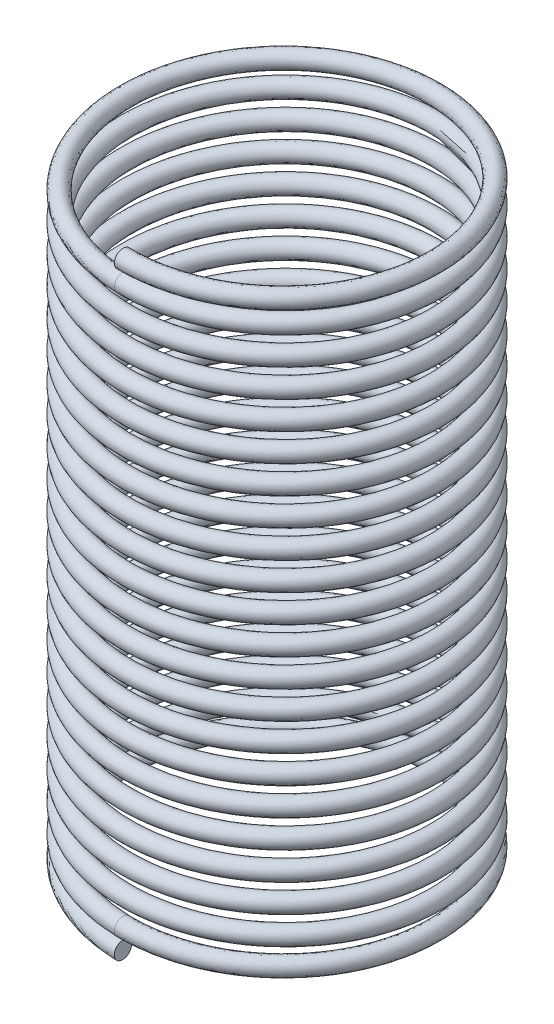
from build123d import *

# Parameters (mm, degrees)
SKETCH9_R = 0.25


with BuildPart() as part:
    # Sweep3: sweep along a curve in space
    with BuildLine() as sweep3_path:
        add(Edge.make_bspline(
            [(0, -0.6, 4.5), (-0.585272672, -0.587580128, 4.5), (-1.768623705, -0.562462812, 4.265693422), (-3.264360697, -0.525009964, 3.2648204), (-4.265816599, -0.48749733, 1.766908068), (-4.617120285, -0.450000715, 0), (-4.265702263, -0.412499808, -1.766908068), (-3.264818043, -0.375000051, -3.2648204), (-1.766908658, -0.337499987, -4.265693422), (0, -0.3, -4.617153289), (1.766908658, -0.262500013, -4.265693422), (3.264818043, -0.224999949, -3.2648204), (4.265702263, -0.187500192, -1.766908068), (4.617120285, -0.149999285, 0), (4.265816599, -0.11250267, 1.766908068), (3.264360697, -0.074990036, 3.2648204), (1.768623705, -0.037537188, 4.265693422), (0.585272672, -0.012419872, 4.5), (0, 0, 4.5)],
            knots=[0, 0, 0, 0, 0.0625, 0.125, 0.1875, 0.25, 0.3125, 0.375, 0.4375, 0.5, 0.5625, 0.625, 0.6875, 0.75, 0.8125, 0.875, 0.9375, 1, 1, 1, 1], degree=3))
        add(Edge.make_bspline(
            [(0, 0, 4.5), (-0.585274074, 0.016766867, 4.5), (-1.768623055, 0.050675185, 4.265693422), (-3.264360871, 0.101236553, 3.2648204), (-4.265816553, 0.151878603, 1.766908068), (-4.617120296, 0.202499035, 0), (-4.265702262, 0.253125259, -1.766908068), (-3.264818032, 0.303749931, -3.2648204), (-1.766908703, 0.354375019, -4.265693422), (1.7e-07, 0.404999995, -4.617153289), (1.766908023, 0.455625001, -4.265693422), (3.264820413, 0.50625, -3.2648204), (4.265693419, 0.556875, -1.766908068), (4.61715329, 0.6075, 0), (4.265693422, 0.658125, 1.766908068), (3.2648204, 0.70875, 3.2648204), (1.766908068, 0.759375, 4.265693422), (0, 0.81, 4.617153289), (-1.766908068, 0.860625, 4.265693422), (-3.2648204, 0.91125, 3.2648204), (-4.265693422, 0.961875, 1.766908068), (-4.617153289, 1.0125, 0), (-4.265693422, 1.063125, -1.766908068), (-3.2648204, 1.11375, -3.2648204), (-1.766908068, 1.164375, -4.265693422), (0, 1.215, -4.617153289), (1.766908068, 1.265625, -4.265693422), (3.2648204, 1.31625, -3.2648204), (4.265693422, 1.366875, -1.766908068), (4.617153289, 1.4175, 0), (4.265693422, 1.468125, 1.766908068), (3.2648204, 1.51875, 3.2648204), (1.766908068, 1.569375, 4.265693422), (0, 1.62, 4.617153289), (-1.766908068, 1.670625, 4.265693422), (-3.2648204, 1.72125, 3.2648204), (-4.265693422, 1.771875, 1.766908068), (-4.617153289, 1.8225, 0), (-4.265693422, 1.873125, -1.766908068), (-3.2648204, 1.92375, -3.2648204), (-1.766908068, 1.974375, -4.265693422), (0, 2.025, -4.617153289), (1.766908068, 2.075625, -4.265693422), (3.2648204, 2.12625, -3.2648204), (4.265693422, 2.176875, -1.766908068), (4.617153289, 2.2275, 0), (4.265693422, 2.278125, 1.766908068), (3.2648204, 2.32875, 3.2648204), (1.766908068, 2.379375, 4.265693422), (0, 2.43, 4.617153289), (-1.766908068, 2.480625, 4.265693422), (-3.2648204, 2.53125, 3.2648204), (-4.265693422, 2.581875, 1.766908068), (-4.617153289, 2.6325, 0), (-4.265693422, 2.683125, -1.766908068), (-3.2648204, 2.73375, -3.2648204), (-1.766908068, 2.784375, -4.265693422), (0, 2.835, -4.617153289), (1.766908068, 2.885625, -4.265693422), (3.2648204, 2.93625, -3.2648204), (4.265693422, 2.986875, -1.766908068), (4.617153289, 3.0375, 0), (4.265693422, 3.088125, 1.766908068), (3.2648204, 3.13875, 3.2648204), (1.766908068, 3.189375, 4.265693422), (0, 3.24, 4.617153289), (-1.766908068, 3.290625, 4.265693422), (-3.2648204, 3.34125, 3.2648204), (-4.265693422, 3.391875, 1.766908068), (-4.617153289, 3.4425, 0), (-4.265693422, 3.493125, -1.766908068), (-3.2648204, 3.54375, -3.2648204), (-1.766908068, 3.594375, -4.265693422), (0, 3.645, -4.617153289), (1.766908068, 3.695625, -4.265693422), (3.2648204, 3.74625, -3.2648204), (4.265693422, 3.796875, -1.766908068), (4.617153289, 3.8475, 0), (4.265693422, 3.898125, 1.766908068), (3.2648204, 3.94875, 3.2648204), (1.766908068, 3.999375, 4.265693422), (0, 4.05, 4.617153289), (-1.766908068, 4.100625, 4.265693422), (-3.2648204, 4.15125, 3.2648204), (-4.265693422, 4.201875, 1.766908068), (-4.617153289, 4.2525, 0), (-4.265693422, 4.303125, -1.766908068), (-3.2648204, 4.35375, -3.2648204), (-1.766908068, 4.404375, -4.265693422), (0, 4.455, -4.617153289), (1.766908068, 4.505625, -4.265693422), (3.2648204, 4.55625, -3.2648204), (4.265693422, 4.606875, -1.766908068), (4.617153289, 4.6575, 0), (4.265693422, 4.708125, 1.766908068), (3.2648204, 4.75875, 3.2648204), (1.766908068, 4.809375, 4.265693422), (0, 4.86, 4.617153289), (-1.766908068, 4.910625, 4.265693422), (-3.2648204, 4.96125, 3.2648204), (-4.265693422, 5.011875, 1.766908068), (-4.617153289, 5.0625, 0), (-4.265693422, 5.113125, -1.766908068), (-3.2648204, 5.16375, -3.2648204), (-1.766908068, 5.214375, -4.265693422), (0, 5.265, -4.617153289), (1.766908068, 5.315625, -4.265693422), (3.2648204, 5.36625, -3.2648204), (4.265693422, 5.416875, -1.766908068), (4.617153289, 5.4675, 0), (4.265693422, 5.518125, 1.766908068), (3.2648204, 5.56875, 3.2648204), (1.766908068, 5.619375, 4.265693422), (0, 5.67, 4.617153289), (-1.766908068, 5.720625, 4.265693422), (-3.2648204, 5.77125, 3.2648204), (-4.265693422, 5.821875, 1.766908068), (-4.617153289, 5.8725, 0), (-4.265693422, 5.923125, -1.766908068), (-3.2648204, 5.97375, -3.2648204), (-1.766908068, 6.024375, -4.265693422), (0, 6.075, -4.617153289), (1.766908068, 6.125625, -4.265693422), (3.2648204, 6.17625, -3.2648204), (4.265693422, 6.226875, -1.766908068), (4.617153289, 6.2775, 0), (4.265693422, 6.328125, 1.766908068), (3.2648204, 6.37875, 3.2648204), (1.766908068, 6.429375, 4.265693422), (0, 6.48, 4.617153289), (-1.766908068, 6.530625, 4.265693422), (-3.2648204, 6.58125, 3.2648204), (-4.265693422, 6.631875, 1.766908068), (-4.617153289, 6.6825, 0), (-4.265693422, 6.733125, -1.766908068), (-3.2648204, 6.78375, -3.2648204), (-1.766908068, 6.834375, -4.265693422), (0, 6.885, -4.617153289), (1.766908068, 6.935625, -4.265693422), (3.2648204, 6.98625, -3.2648204), (4.265693422, 7.036875, -1.766908068), (4.617153289, 7.0875, 0), (4.265693422, 7.138125, 1.766908068), (3.2648204, 7.18875, 3.2648204), (1.766908068, 7.239375, 4.265693422), (0, 7.29, 4.617153289), (-1.766908068, 7.340625, 4.265693422), (-3.2648204, 7.39125, 3.2648204), (-4.265693422, 7.441875, 1.766908068), (-4.617153289, 7.4925, 0), (-4.265693422, 7.543125, -1.766908068), (-3.2648204, 7.59375, -3.2648204), (-1.766908068, 7.644375, -4.265693422), (0, 7.695, -4.617153289), (1.766908068, 7.745625, -4.265693422), (3.2648204, 7.79625, -3.2648204), (4.265693422, 7.846875, -1.766908068), (4.617153289, 7.8975, 0), (4.265693422, 7.948125, 1.766908068), (3.2648204, 7.99875, 3.2648204), (1.766908068, 8.049375, 4.265693422), (0, 8.1, 4.617153289), (-1.766908068, 8.150625, 4.265693422), (-3.2648204, 8.20125, 3.2648204), (-4.265693422, 8.251875, 1.766908068), (-4.617153289, 8.3025, 0), (-4.265693422, 8.353125, -1.766908068), (-3.2648204, 8.40375, -3.2648204), (-1.766908068, 8.454375, -4.265693422), (0, 8.505, -4.617153289), (1.766908068, 8.555625, -4.265693422), (3.2648204, 8.60625, -3.2648204), (4.265693422, 8.656875, -1.766908068), (4.617153289, 8.7075, 0), (4.265693422, 8.758125, 1.766908068), (3.2648204, 8.80875, 3.2648204), (1.766908068, 8.859375, 4.265693422), (0, 8.91, 4.617153289), (-1.766908068, 8.960625, 4.265693422), (-3.2648204, 9.01125, 3.2648204), (-4.265693422, 9.061875, 1.766908068), (-4.617153289, 9.1125, 0), (-4.265693422, 9.163125, -1.766908068), (-3.2648204, 9.21375, -3.2648204), (-1.766908068, 9.264375, -4.265693422), (0, 9.315, -4.617153289), (1.766908068, 9.365625, -4.265693422), (3.2648204, 9.41625, -3.2648204), (4.265693422, 9.466875, -1.766908068), (4.617153289, 9.5175, 0), (4.265693422, 9.568125, 1.766908068), (3.2648204, 9.61875, 3.2648204), (1.766908068, 9.669375, 4.265693422), (0, 9.72, 4.617153289), (-1.766908068, 9.770625, 4.265693422), (-3.2648204, 9.82125, 3.2648204), (-4.265693422, 9.871875, 1.766908068), (-4.617153289, 9.9225, 0), (-4.265693422, 9.973125, -1.766908068), (-3.2648204, 10.02375, -3.2648204), (-1.766908068, 10.074375, -4.265693422), (0, 10.125, -4.617153289), (1.766908068, 10.175625, -4.265693422), (3.2648204, 10.22625, -3.2648204), (4.265693422, 10.276875, -1.766908068), (4.617153289, 10.3275, 0), (4.265693422, 10.378125, 1.766908068), (3.2648204, 10.42875, 3.2648204), (1.766908068, 10.479375, 4.265693422), (0, 10.53, 4.617153289), (-1.766908068, 10.580625, 4.265693422), (-3.2648204, 10.63125, 3.2648204), (-4.265693422, 10.681875, 1.766908068), (-4.617153289, 10.7325, 0), (-4.265693422, 10.783125, -1.766908068), (-3.2648204, 10.83375, -3.2648204), (-1.766908068, 10.884375, -4.265693422), (0, 10.935, -4.617153289), (1.766908068, 10.985625, -4.265693422), (3.2648204, 11.03625, -3.2648204), (4.265693422, 11.086875, -1.766908068), (4.617153289, 11.1375, 0), (4.265693422, 11.188125, 1.766908068), (3.2648204, 11.23875, 3.2648204), (1.766908068, 11.289375, 4.265693422), (0, 11.34, 4.617153289), (-1.766908068, 11.390625, 4.265693422), (-3.2648204, 11.44125, 3.2648204), (-4.265693422, 11.491875, 1.766908068), (-4.617153289, 11.5425, 0), (-4.265693422, 11.593125, -1.766908068), (-3.2648204, 11.64375, -3.2648204), (-1.766908068, 11.694375, -4.265693422), (0, 11.745, -4.617153289), (1.766908068, 11.795625, -4.265693422), (3.2648204, 11.84625, -3.2648204), (4.265693422, 11.896875, -1.766908068), (4.617153289, 11.9475, 0), (4.265693422, 11.998125, 1.766908068), (3.2648204, 12.04875, 3.2648204), (1.766908068, 12.099375, 4.265693422), (0, 12.15, 4.617153289), (-1.766908068, 12.200625, 4.265693422), (-3.2648204, 12.25125, 3.2648204), (-4.265693422, 12.301875, 1.766908068), (-4.617153289, 12.3525, 0), (-4.265693422, 12.403125, -1.766908068), (-3.2648204, 12.45375, -3.2648204), (-1.766908068, 12.504375, -4.265693422), (0, 12.555, -4.617153289), (1.766908068, 12.605625, -4.265693422), (3.2648204, 12.65625, -3.2648204), (4.265693422, 12.706875, -1.766908068), (4.617153289, 12.7575, 0), (4.265693422, 12.808125, 1.766908068), (3.2648204, 12.85875, 3.2648204), (1.766908068, 12.909375, 4.265693422), (0, 12.96, 4.617153289), (-1.766908068, 13.010625, 4.265693422), (-3.2648204, 13.06125, 3.2648204), (-4.265693422, 13.111875, 1.766908068), (-4.617153289, 13.1625, 0), (-4.265693422, 13.213125, -1.766908068), (-3.2648204, 13.26375, -3.2648204), (-1.766908068, 13.314375, -4.265693422), (0, 13.365, -4.617153289), (1.766908068, 13.415625, -4.265693422), (3.2648204, 13.46625, -3.2648204), (4.265693422, 13.516875, -1.766908068), (4.617153289, 13.5675, 0), (4.265693422, 13.618125, 1.766908068), (3.2648204, 13.66875, 3.2648204), (1.766908068, 13.719375, 4.265693422), (0, 13.77, 4.617153289), (-1.766908068, 13.820625, 4.265693422), (-3.2648204, 13.87125, 3.2648204), (-4.265693422, 13.921875, 1.766908068), (-4.617153289, 13.9725, 0), (-4.265693422, 14.023125, -1.766908068), (-3.2648204, 14.07375, -3.2648204), (-1.766908068, 14.124375, -4.265693422), (0, 14.175, -4.617153289), (1.766908068, 14.225625, -4.265693422), (3.2648204, 14.27625, -3.2648204), (4.265693422, 14.326875, -1.766908068), (4.617153289, 14.3775, 0), (4.265693422, 14.428125, 1.766908068), (3.2648204, 14.47875, 3.2648204), (1.766908068, 14.529375, 4.265693422), (0, 14.58, 4.617153289), (-1.766908068, 14.630625, 4.265693422), (-3.2648204, 14.68125, 3.2648204), (-4.265693422, 14.731875, 1.766908068), (-4.617153289, 14.7825, 0), (-4.265693422, 14.833125, -1.766908068), (-3.2648204, 14.88375, -3.2648204), (-1.766908068, 14.934375, -4.265693422), (0, 14.985, -4.617153289), (1.766908068, 15.035625, -4.265693422), (3.2648204, 15.08625, -3.2648204), (4.265693422, 15.136875, -1.766908068), (4.617153289, 15.1875, 0), (4.265693422, 15.238125, 1.766908068), (3.2648204, 15.28875, 3.2648204), (1.766908068, 15.339375, 4.265693422), (0, 15.39, 4.617153289), (-1.766908068, 15.440625, 4.265693422), (-3.2648204, 15.49125, 3.2648204), (-4.265693422, 15.541875, 1.766908068), (-4.61715329, 15.5925, 0), (-4.265693419, 15.643125, -1.766908068), (-3.264820413, 15.69375, -3.2648204), (-1.766908023, 15.744374999, -4.265693422), (-1.7e-07, 15.795000005, -4.617153289), (1.766908703, 15.845624981, -4.265693422), (3.264818032, 15.896250069, -3.2648204), (4.265702262, 15.946874741, -1.766908068), (4.617120296, 15.997500965, 0), (4.265816553, 16.048121397, 1.766908068), (3.264360871, 16.098763447, 3.2648204), (1.768623055, 16.149324815, 4.265693422), (0.585274074, 16.183233133, 4.5), (0, 16.2, 4.5)],
            knots=[0, 0, 0, 0, 0.003125, 0.00625, 0.009375, 0.0125, 0.015625, 0.01875, 0.021875, 0.025, 0.028125, 0.03125, 0.034375, 0.0375, 0.040625, 0.04375, 0.046875, 0.05, 0.053125, 0.05625, 0.059375, 0.0625, 0.065625, 0.06875, 0.071875, 0.075, 0.078125, 0.08125, 0.084375, 0.0875, 0.090625, 0.09375, 0.096875, 0.1, 0.103125, 0.10625, 0.109375, 0.1125, 0.115625, 0.11875, 0.121875, 0.125, 0.128125, 0.13125, 0.134375, 0.1375, 0.140625, 0.14375, 0.146875, 0.15, 0.153125, 0.15625, 0.159375, 0.1625, 0.165625, 0.16875, 0.171875, 0.175, 0.178125, 0.18125, 0.184375, 0.1875, 0.190625, 0.19375, 0.196875, 0.2, 0.203125, 0.20625, 0.209375, 0.2125, 0.215625, 0.21875, 0.221875, 0.225, 0.228125, 0.23125, 0.234375, 0.2375, 0.240625, 0.24375, 0.246875, 0.25, 0.253125, 0.25625, 0.259375, 0.2625, 0.265625, 0.26875, 0.271875, 0.275, 0.278125, 0.28125, 0.284375, 0.2875, 0.290625, 0.29375, 0.296875, 0.3, 0.303125, 0.30625, 0.309375, 0.3125, 0.315625, 0.31875, 0.321875, 0.325, 0.328125, 0.33125, 0.334375, 0.3375, 0.340625, 0.34375, 0.346875, 0.35, 0.353125, 0.35625, 0.359375, 0.3625, 0.365625, 0.36875, 0.371875, 0.375, 0.378125, 0.38125, 0.384375, 0.3875, 0.390625, 0.39375, 0.396875, 0.4, 0.403125, 0.40625, 0.409375, 0.4125, 0.415625, 0.41875, 0.421875, 0.425, 0.428125, 0.43125, 0.434375, 0.4375, 0.440625, 0.44375, 0.446875, 0.45, 0.453125, 0.45625, 0.459375, 0.4625, 0.465625, 0.46875, 0.471875, 0.475, 0.478125, 0.48125, 0.484375, 0.4875, 0.490625, 0.49375, 0.496875, 0.5, 0.503125, 0.50625, 0.509375, 0.5125, 0.515625, 0.51875, 0.521875, 0.525, 0.528125, 0.53125, 0.534375, 0.5375, 0.540625, 0.54375, 0.546875, 0.55, 0.553125, 0.55625, 0.559375, 0.5625, 0.565625, 0.56875, 0.571875, 0.575, 0.578125, 0.58125, 0.584375, 0.5875, 0.590625, 0.59375, 0.596875, 0.6, 0.603125, 0.60625, 0.609375, 0.6125, 0.615625, 0.61875, 0.621875, 0.625, 0.628125, 0.63125, 0.634375, 0.6375, 0.640625, 0.64375, 0.646875, 0.65, 0.653125, 0.65625, 0.659375, 0.6625, 0.665625, 0.66875, 0.671875, 0.675, 0.678125, 0.68125, 0.684375, 0.6875, 0.690625, 0.69375, 0.696875, 0.7, 0.703125, 0.70625, 0.709375, 0.7125, 0.715625, 0.71875, 0.721875, 0.725, 0.728125, 0.73125, 0.734375, 0.7375, 0.740625, 0.74375, 0.746875, 0.75, 0.753125, 0.75625, 0.759375, 0.7625, 0.765625, 0.76875, 0.771875, 0.775, 0.778125, 0.78125, 0.784375, 0.7875, 0.790625, 0.79375, 0.796875, 0.8, 0.803125, 0.80625, 0.809375, 0.8125, 0.815625, 0.81875, 0.821875, 0.825, 0.828125, 0.83125, 0.834375, 0.8375, 0.840625, 0.84375, 0.846875, 0.85, 0.853125, 0.85625, 0.859375, 0.8625, 0.865625, 0.86875, 0.871875, 0.875, 0.878125, 0.88125, 0.884375, 0.8875, 0.890625, 0.89375, 0.896875, 0.9, 0.903125, 0.90625, 0.909375, 0.9125, 0.915625, 0.91875, 0.921875, 0.925, 0.928125, 0.93125, 0.934375, 0.9375, 0.940625, 0.94375, 0.946875, 0.95, 0.953125, 0.95625, 0.959375, 0.9625, 0.965625, 0.96875, 0.971875, 0.975, 0.978125, 0.98125, 0.984375, 0.9875, 0.990625, 0.99375, 0.996875, 1, 1, 1, 1], degree=3))
        add(Edge.make_bspline(
            [(0, 16.2, 4.5), (-0.585272672, 16.212419872, 4.5), (-1.768623705, 16.237537188, 4.265693422), (-3.264360697, 16.274990036, 3.2648204), (-4.265816599, 16.31250267, 1.766908068), (-4.617120285, 16.349999285, 0), (-4.265702263, 16.387500192, -1.766908068), (-3.264818043, 16.424999949, -3.2648204), (-1.766908658, 16.462500013, -4.265693422), (0, 16.5, -4.617153289), (1.766908658, 16.537499987, -4.265693422), (3.264818043, 16.575000051, -3.2648204), (4.265702263, 16.612499808, -1.766908068), (4.617120285, 16.650000715, 0), (4.265816599, 16.68749733, 1.766908068), (3.264360697, 16.725009964, 3.2648204), (1.768623705, 16.762462812, 4.265693422), (0.585272672, 16.787580128, 4.5), (0, 16.8, 4.5)],
            knots=[0, 0, 0, 0, 0.0625, 0.125, 0.1875, 0.25, 0.3125, 0.375, 0.4375, 0.5, 0.5625, 0.625, 0.6875, 0.75, 0.8125, 0.875, 0.9375, 1, 1, 1, 1], degree=3))
    # Sketch9 → Sweep3 (sweep)
    with BuildSketch(Plane(origin=(0, -0.6, 4.5), x_dir=(0, 0, -1), z_dir=(0.9997749178299158, -0.021215882686923065, -1.3334807804178297e-14))):
        with Locations((0.023180512, 0.035307657)):
            Circle(SKETCH9_R)
    sweep(path=sweep3_path.line, is_frenet=True, transition=Transition.RIGHT)


solid = part.part
